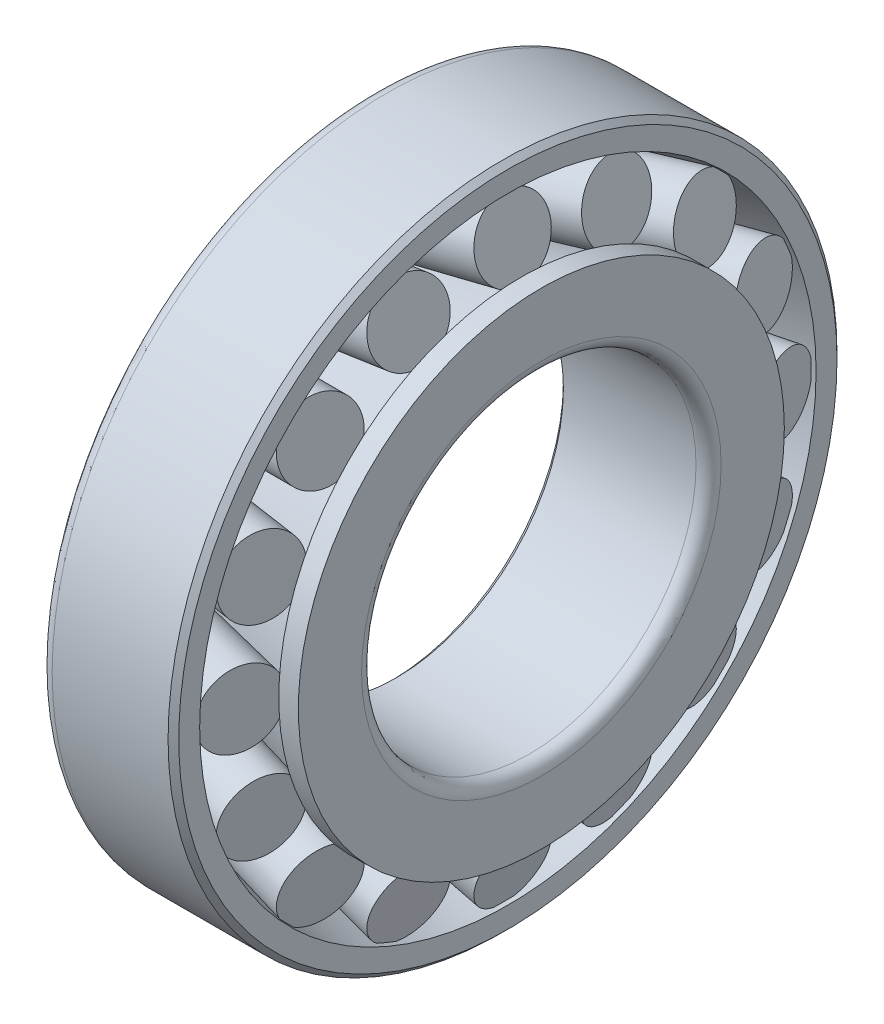
from build123d import *

# Parameters (mm, degrees)
ROLLERSDETAILED_COUNT = 16
ROLLERSDETAILED_ANGLE = 337.5


with BuildPart() as part:
    # OutRacSke → OuterRace (revolve)
    with BuildSketch(Plane.XY, mode=Mode.PRIVATE) as outerrace_sk:
        with BuildLine():
            Line((-4, 36.860180807), (-20, 32.865))
            Line((-20, 32.865), (-20, 38.5))
            ThreePointArc((-20, 38.5), (-19.560660172, 39.560660172), (-18.5, 40))
            Line((-18.5, 40), (-4.64, 40))
            Line((-4.64, 40), (-4, 39.36))
            Line((-4, 39.36), (-4, 36.860180807))
        make_face()
    outerrace = revolve(outerrace_sk.sketch.rotate(Axis((-42.5, 0, 0), (1, 0, 0)), 270), axis=Axis((-42.5, 0, 0), (1, 0, 0)))

    # RolDetSke → RollerDetailed (revolve)
    with BuildSketch(Plane.XY):
        Polygon((-17.409827399, 29.03979545), (-18.5, 33.405745942), (-4.528958425, 36.894298264), (-3.438785824, 32.528347772), align=None)
    rollerdetailed = revolve(axis=Axis((-41.886626423, 22.927968094, 0), (0.9702112204916999, 0.24226057795688918, 0)))

    # RollersDetailed: OuterRace, RollerDetailed ×16 about axis
    rollersdetailed_axis = Axis((-50, 0, 0), (1, 0, 0))
    add([outerrace.rotate(rollersdetailed_axis, i * ROLLERSDETAILED_ANGLE / (ROLLERSDETAILED_COUNT - 1)) for i in range(1, ROLLERSDETAILED_COUNT)])
    add([rollerdetailed.rotate(rollersdetailed_axis, i * ROLLERSDETAILED_ANGLE / (ROLLERSDETAILED_COUNT - 1)) for i in range(1, ROLLERSDETAILED_COUNT)])

    # InsRacSke → InnerRace (revolve)
    with BuildSketch(Plane.XY, mode=Mode.PRIVATE) as innerrace_sk:
        with BuildLine():
            Line((-16.421117532, 25.123844957), (-18, 25.123844957))
            Line((-18, 25.123844957), (-18, 20.64))
            Line((-18, 20.64), (-17.36, 20))
            Line((-17.36, 20), (-1.5, 20))
            ThreePointArc((-1.5, 20), (-0.439339828, 20.439339828), (0, 21.5))
            Line((0, 21.5), (0, 29.06239728))
            Line((0, 29.06239728), (-2.337711497, 29.06239728))
            Line((-2.337711497, 29.06239728), (-2.337711497, 28.16239728))
            Line((-2.337711497, 28.16239728), (-16.308753072, 24.673844957))
            Line((-16.308753072, 24.673844957), (-16.421117532, 25.123844957))
        make_face()
    revolve(innerrace_sk.sketch.rotate(Axis((-42.5, 0, 0), (1, 0, 0)), 270), axis=Axis((-42.5, 0, 0), (1, 0, 0)))


solid = part.part
